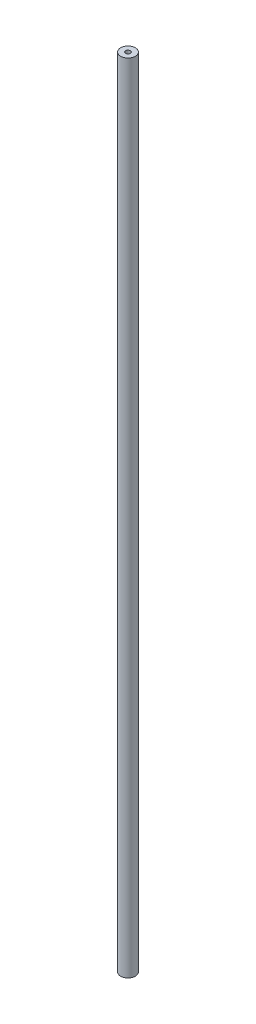
from build123d import *

# Parameters (mm, degrees)
SKETCH1_R                  = 6.35
BOSS_EXTRUDE1_DEPTH        = 685.8
F_10_32_TAPPED_HOLE1_D     = 4.0386
F_10_32_TAPPED_HOLE1_DEPTH = 12.02944
F_10_32_TAPPED_HOLE1_TIP   = 1.213317848
F_10_32_TAPPED_HOLE2_D     = 4.0386
F_10_32_TAPPED_HOLE2_DEPTH = 12.02944
F_10_32_TAPPED_HOLE2_TIP   = 1.213317848


with BuildPart() as part:
    # Sketch1 → Boss-Extrude1 (new body)
    with BuildSketch(Plane(origin=(0, 0, 0), x_dir=(1, 0, 0), z_dir=(0, 1, 0))):
        Circle(SKETCH1_R)
    extrude(amount=BOSS_EXTRUDE1_DEPTH)

    # #10-32 Tapped Hole1
    with Locations(Plane(origin=(0, 0, 0), x_dir=(-1, 0, 0), z_dir=(0, -1, 0))):
        with Locations((0, 0)):
            Hole(F_10_32_TAPPED_HOLE1_D / 2, depth=F_10_32_TAPPED_HOLE1_DEPTH)
            with Locations((0, 0, -(F_10_32_TAPPED_HOLE1_DEPTH + F_10_32_TAPPED_HOLE1_TIP / 2))):  # 118° drill point
                Cone(0, F_10_32_TAPPED_HOLE1_D / 2, F_10_32_TAPPED_HOLE1_TIP, mode=Mode.SUBTRACT)

    # #10-32 Tapped Hole2
    with Locations(Plane(origin=(0, 685.8, 0), x_dir=(1, 0, 0), z_dir=(0, 1, 0))):
        with Locations((0, 0)):
            Hole(F_10_32_TAPPED_HOLE2_D / 2, depth=F_10_32_TAPPED_HOLE2_DEPTH)
            with Locations((0, 0, -(F_10_32_TAPPED_HOLE2_DEPTH + F_10_32_TAPPED_HOLE2_TIP / 2))):  # 118° drill point
                Cone(0, F_10_32_TAPPED_HOLE2_D / 2, F_10_32_TAPPED_HOLE2_TIP, mode=Mode.SUBTRACT)


solid = part.part
